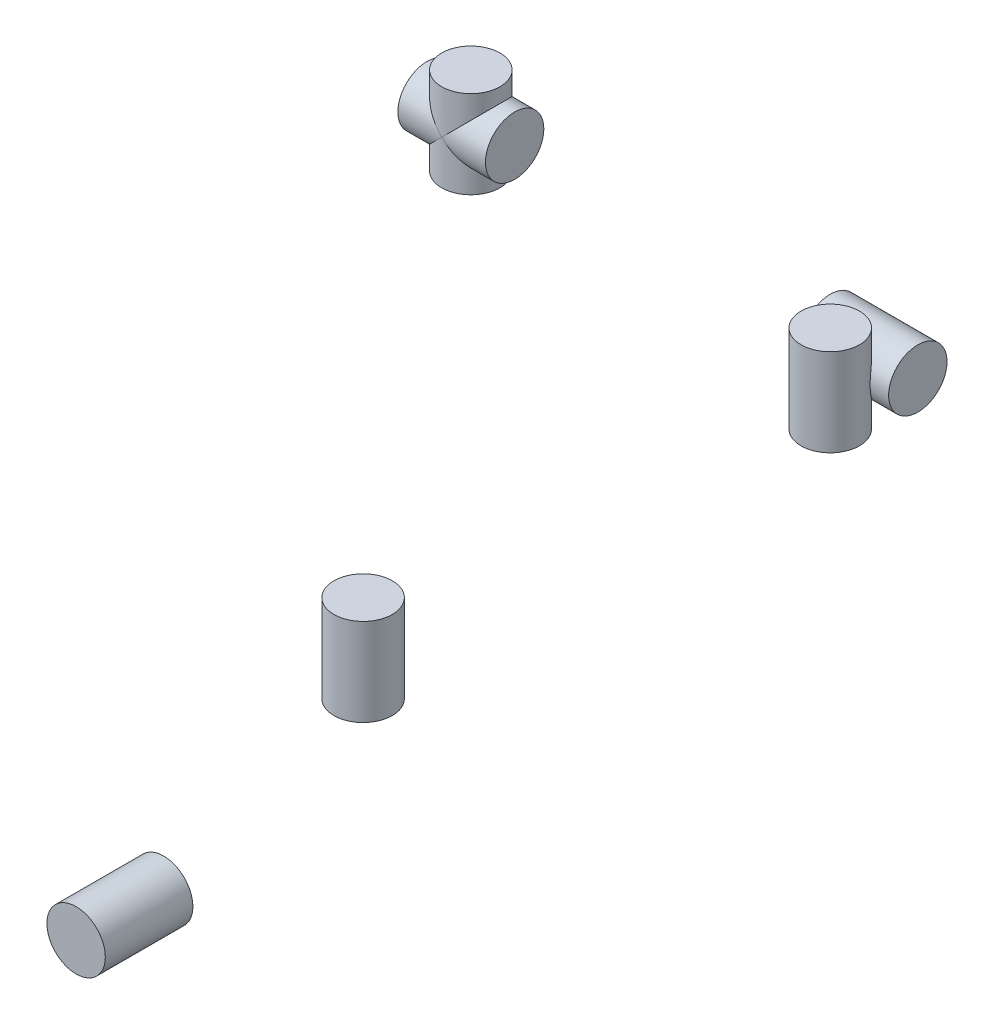
from build123d import *

# Parameters (mm, degrees)
SKETCH2_R                  = 10
BOSS_EXTRUDE1_DEPTH        = 30
BOSS_EXTRUDE3_DEPTH        = 15
BOSS_EXTRUDE3_DEPTH_BACK   = 15
SKETCH4_R                  = 10
BOSS_EXTRUDE3_2_DEPTH      = 15
BOSS_EXTRUDE3_2_DEPTH_BACK = 15
BOSS_EXTRUDE3_3_DEPTH      = 15
BOSS_EXTRUDE3_3_DEPTH_BACK = 15
BOSS_EXTRUDE4_DEPTH        = 15
BOSS_EXTRUDE4_DEPTH_BACK   = 15
SKETCH5_R                  = 10
BOSS_EXTRUDE5_DEPTH        = 15
BOSS_EXTRUDE5_DEPTH_BACK   = 15
SKETCH6_R                  = 10


with BuildPart() as part:
    # Sketch2 → Boss-Extrude1 (new body)
    with BuildSketch(Plane.XY):
        Circle(SKETCH2_R)
    extrude(amount=-BOSS_EXTRUDE1_DEPTH)


with BuildPart() as body_2:
    # Sketch4 → Boss-Extrude3 (new, two sides: drawn at the far end of the back side and taken through both)
    with BuildSketch(Plane(origin=(0, 0, 0), x_dir=(1, 0, 0), z_dir=(0, 1, 0)).offset(-BOSS_EXTRUDE3_DEPTH_BACK)):
        with Locations((-37.5, 135.8)):
            Circle(SKETCH4_R)
    extrude(amount=BOSS_EXTRUDE3_DEPTH + BOSS_EXTRUDE3_DEPTH_BACK)


with BuildPart() as body_3:
    # Sketch4 → Boss-Extrude3 2 (new, two sides: drawn at the far end of the back side and taken through both)
    with BuildSketch(Plane(origin=(0, 0, 0), x_dir=(1, 0, 0), z_dir=(0, 1, 0)).offset(-BOSS_EXTRUDE3_2_DEPTH_BACK)):
        with Locations((-37.5, 295.8)):
            Circle(SKETCH4_R)
    extrude(amount=BOSS_EXTRUDE3_2_DEPTH + BOSS_EXTRUDE3_2_DEPTH_BACK)

    # Sketch5 → Boss-Extrude4 (add, two sides: drawn at the far end of the back side and taken through both)
    with BuildSketch(Plane(origin=(-37.5, 0, 0), x_dir=(0, 0, -1), z_dir=(1, 0, 0)).offset(-BOSS_EXTRUDE4_DEPTH_BACK)):
        with Locations((310.8, 0)):
            Circle(SKETCH5_R)
    extrude(amount=BOSS_EXTRUDE4_DEPTH + BOSS_EXTRUDE4_DEPTH_BACK)


with BuildPart() as body_4:
    # Sketch4 → Boss-Extrude3 3 (new, two sides: drawn at the far end of the back side and taken through both)
    with BuildSketch(Plane(origin=(0, 0, 0), x_dir=(1, 0, 0), z_dir=(0, 1, 0)).offset(-BOSS_EXTRUDE3_3_DEPTH_BACK)):
        with Locations((-175.6, 310.8)):
            Circle(SKETCH4_R)
    extrude(amount=BOSS_EXTRUDE3_3_DEPTH + BOSS_EXTRUDE3_3_DEPTH_BACK)

    # Sketch6 → Boss-Extrude5 (add, two sides: drawn at the far end of the back side and taken through both)
    with BuildSketch(Plane(origin=(-175.6, 0, 0), x_dir=(0, 0, -1), z_dir=(1, 0, 0)).offset(-BOSS_EXTRUDE5_DEPTH_BACK)):
        with Locations((310.8, 0)):
            Circle(SKETCH6_R)
    extrude(amount=BOSS_EXTRUDE5_DEPTH + BOSS_EXTRUDE5_DEPTH_BACK)


solid = Compound([part.part, body_2.part, body_3.part, body_4.part])
